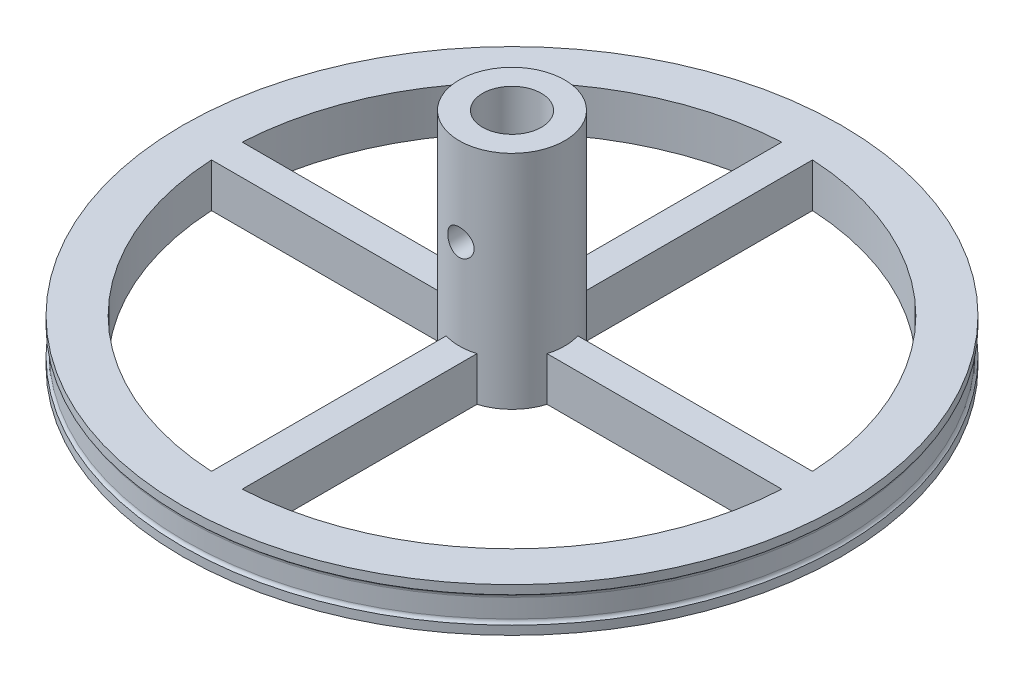
from build123d import *

# Parameters (mm, degrees)
REVOLVE1_ANGLE                 = 90
BOSS_EXTRUDE2_DEPTH            = 22.5
CUT_EXTRUDE1_DEPTH             = 57.762672959
MIRROR3_START                  = -2.736132077
MIRROR3_DEPTH                  = 5
MIRROR3_START_2                = 2.263867923
MIRROR3_2_DEPTH                = 20.236132077
MIRROR3_3_DEPTH                = 1
MIRROR3_START_3                = 1.263867923
MIRROR3_4_DEPTH                = 1
MIRROR4_START                  = -2.736132077
MIRROR4_DEPTH                  = 5
MIRROR4_START_2                = 2.263867923
MIRROR4_2_DEPTH                = 20.236132077
MIRROR4_3_DEPTH                = 1
MIRROR4_START_3                = 1.263867923
MIRROR4_4_DEPTH                = 1
SKETCH7_R                      = 3.35
CUT_EXTRUDE2_DEPTH             = 20
FILLET9_R                      = 0.5
CUT_EXTRUDE3_REACH             = 59.609
SKETCH8_R                      = 1.5
CUT_EXTRUDE3_DIRECTION_2_REACH = 59.609


# Read off the part's stored shape, not the designer's step: Mirror3, Mirror4
with BuildPart() as part:
    # Sketch1 → Revolve1 (revolve)
    with BuildSketch(Plane.XY):
        Polygon((0, 2.263867923), (0, -2.736132077), (37.5, -2.736132077), (37.5, -1.736132077), (37.25, -1.736132077), (37.25, 1.263867923), (37.5, 1.263867923), (37.5, 2.263867923), align=None)
    revolve(axis=Axis((0, 2.263867923, 0), (0, -1, 0)), revolution_arc=REVOLVE1_ANGLE)

    # Sketch2 → Boss-Extrude2 (add)
    with BuildSketch(Plane(origin=(0, 0, 0), x_dir=(1, 0, 0), z_dir=(0, 1, 0))):
        with BuildLine():
            Line((0, 0), (6, 0))
            ThreePointArc((6, 0), (4.242640687, -4.242640687), (0, -6))
            Line((0, -6), (0, 0))
        make_face()
    extrude(amount=BOSS_EXTRUDE2_DEPTH)

    # Sketch6 → Cut-Extrude1 (cut, through all)
    with BuildSketch(Plane(origin=(0, 2.263867923, 0), x_dir=(1, 0, 0), z_dir=(0, 1, 0))):
        with BuildLine():
            Line((1.75, -5.739120142), (1.75, -32.452850414))
            ThreePointArc((1.75, -32.452850414), (22.980970389, -22.980970389), (32.452850414, -1.75))
            Line((32.452850414, -1.75), (5.739120142, -1.75))
            ThreePointArc((5.739120142, -1.75), (4.242640687, -4.242640687), (1.75, -5.739120142))
        make_face()
    extrude(amount=-CUT_EXTRUDE1_DEPTH, mode=Mode.SUBTRACT)

    # Mirror3 outline → Mirror3 (add)
    with BuildSketch(Plane(origin=(0, 0, 0), x_dir=(1, 0, 0), z_dir=(0, 1, 0)).offset(MIRROR3_START)):
        with BuildLine():
            ThreePointArc((37.25, 0), (26.339727599, 26.339727599), (0, 37.25))
            Line((0, 37.25), (0, 0))
            Line((0, 0), (37.25, 0))
        make_face()
        with BuildLine():
            Line((32.452850414, 1.75), (5.739120142, 1.75))
            ThreePointArc((5.739120142, 1.75), (4.242640687, 4.242640687), (1.75, 5.739120142))
            Line((1.75, 5.739120142), (1.75, 32.452850414))
            ThreePointArc((1.75, 32.452850414), (22.980970389, 22.980970389), (32.452850414, 1.75))
        make_face(mode=Mode.SUBTRACT)
    extrude(amount=MIRROR3_DEPTH)

    # Mirror3 2 outline → Mirror3 2 (add)
    with BuildSketch(Plane(origin=(0, 0, 0), x_dir=(1, 0, 0), z_dir=(0, 1, 0)).offset(MIRROR3_START_2)):
        with BuildLine():
            Line((0, 0), (6, 0))
            ThreePointArc((6, 0), (4.242640687, 4.242640687), (0, 6))
            Line((0, 6), (0, 0))
        make_face()
    extrude(amount=MIRROR3_2_DEPTH)

    # Mirror3 3 outline → Mirror3 3 (add)
    with BuildSketch(Plane(origin=(0, 0, 0), x_dir=(1, 0, 0), z_dir=(0, 1, 0)).offset(MIRROR3_START)):
        with BuildLine():
            Line((37.25, 0), (37.5, 0))
            ThreePointArc((37.5, 0), (26.516504294, 26.516504294), (0, 37.5))
            Line((0, 37.5), (0, 37.25))
            ThreePointArc((0, 37.25), (26.339727599, 26.339727599), (37.25, 0))
        make_face()
    extrude(amount=MIRROR3_3_DEPTH)

    # Mirror3 4 outline → Mirror3 4 (add)
    with BuildSketch(Plane(origin=(0, 0, 0), x_dir=(1, 0, 0), z_dir=(0, 1, 0)).offset(MIRROR3_START_3)):
        with BuildLine():
            Line((37.25, 0), (37.5, 0))
            ThreePointArc((37.5, 0), (26.516504294, 26.516504294), (0, 37.5))
            Line((0, 37.5), (0, 37.25))
            ThreePointArc((0, 37.25), (26.339727599, 26.339727599), (37.25, 0))
        make_face()
    extrude(amount=MIRROR3_4_DEPTH)

    # Mirror4 outline → Mirror4 (add)
    with BuildSketch(Plane(origin=(0, 0, 0), x_dir=(1, 0, 0), z_dir=(0, 1, 0)).offset(MIRROR4_START)):
        with BuildLine():
            ThreePointArc((0, 37.25), (-37.25, 0), (0, -37.25))
            Line((0, -37.25), (0, 37.25))
        make_face()
        with BuildLine():
            Line((-1.75, 32.452850414), (-1.75, 5.739120142))
            ThreePointArc((-1.75, 5.739120142), (-4.242640687, 4.242640687), (-5.739120142, 1.75))
            Line((-5.739120142, 1.75), (-32.452850414, 1.75))
            ThreePointArc((-32.452850414, 1.75), (-22.980970389, 22.980970389), (-1.75, 32.452850414))
        make_face(mode=Mode.SUBTRACT)
        with BuildLine():
            Line((-32.452850414, -1.75), (-5.739120142, -1.75))
            ThreePointArc((-5.739120142, -1.75), (-4.242640687, -4.242640687), (-1.75, -5.739120142))
            Line((-1.75, -5.739120142), (-1.75, -32.452850414))
            ThreePointArc((-1.75, -32.452850414), (-22.980970389, -22.980970389), (-32.452850414, -1.75))
        make_face(mode=Mode.SUBTRACT)
    extrude(amount=MIRROR4_DEPTH)

    # Mirror4 2 outline → Mirror4 2 (add)
    with BuildSketch(Plane(origin=(0, 0, 0), x_dir=(1, 0, 0), z_dir=(0, 1, 0)).offset(MIRROR4_START_2)):
        with BuildLine():
            Line((0, -6), (0, 6))
            ThreePointArc((0, 6), (-6, 0), (0, -6))
        make_face()
    extrude(amount=MIRROR4_2_DEPTH)

    # Mirror4 3 outline → Mirror4 3 (add)
    with BuildSketch(Plane(origin=(0, 0, 0), x_dir=(1, 0, 0), z_dir=(0, 1, 0)).offset(MIRROR4_START)):
        with BuildLine():
            Line((0, 37.25), (0, 37.5))
            ThreePointArc((0, 37.5), (-37.5, 0), (0, -37.5))
            Line((0, -37.5), (0, -37.25))
            ThreePointArc((0, -37.25), (-37.25, 0), (0, 37.25))
        make_face()
    extrude(amount=MIRROR4_3_DEPTH)

    # Mirror4 4 outline → Mirror4 4 (add)
    with BuildSketch(Plane(origin=(0, 0, 0), x_dir=(1, 0, 0), z_dir=(0, 1, 0)).offset(MIRROR4_START_3)):
        with BuildLine():
            Line((0, 37.25), (0, 37.5))
            ThreePointArc((0, 37.5), (-37.5, 0), (0, -37.5))
            Line((0, -37.5), (0, -37.25))
            ThreePointArc((0, -37.25), (-37.25, 0), (0, 37.25))
        make_face()
    extrude(amount=MIRROR4_4_DEPTH)

    # Sketch7 → Cut-Extrude2 (cut)
    with BuildSketch(Plane(origin=(0, 22.5, 0), x_dir=(1, 0, 0), z_dir=(0, 1, 0))):
        with Locations(Location((0, 0, 0), (0, 0, 270))):
            Circle(SKETCH7_R)
    extrude(amount=-CUT_EXTRUDE2_DEPTH, mode=Mode.SUBTRACT)

    # Fillet9
    # the kernel refuses this fillet: 0.5 mm, written as the material it adds along each edge
    with BuildSketch(Plane(origin=(0, 1.263867923, 0), x_dir=(0, 0, 1), z_dir=(1, 0, 0))) as fillet9_piece_1:
        with BuildLine():
            CenterArc((37.75, 0.433012702), FILLET9_R, 180, 60)
            Line((37.5, 0), (37.495, -0.008660254))
            ThreePointArc((37.495, -0.008660254), (37.375, -0.01), (37.25, -0.01))
            Line((37.25, -0.01), (37.24, 0))
            Line((37.24, 0), (37.24, 0.433012702))
            Line((37.24, 0.433012702), (37.25, 0.433012702))
        make_face()
    revolve(axis=Axis((0, 1.263867923, 0), (0, -1, 0)), revolution_arc=180)
    with BuildSketch(Plane(origin=(0, -1.736132077, 0), x_dir=(0, 0, 1), z_dir=(1, 0, 0))) as fillet9_piece_2:
        with BuildLine():
            CenterArc((37.75, -0.433012702), FILLET9_R, 120, 60)
            Line((37.25, -0.433012702), (37.24, -0.433012702))
            Line((37.24, -0.433012702), (37.24, 0))
            Line((37.24, 0), (37.25, 0.01))
            ThreePointArc((37.25, 0.01), (37.375, 0.01), (37.495, 0.008660254))
            Line((37.495, 0.008660254), (37.5, 0))
        make_face()
    revolve(axis=Axis((0, -1.736132077, 0), (0, -1, 0)), revolution_arc=180)
    with BuildSketch(Plane(origin=(0, -1.736132077, 0), x_dir=(1, 0, 0), z_dir=(0, 0, -1))) as fillet9_piece_3:
        with BuildLine():
            CenterArc((37.75, -0.433012702), FILLET9_R, 120, 60)
            Line((37.25, -0.433012702), (37.24, -0.433012702))
            Line((37.24, -0.433012702), (37.24, 0))
            Line((37.24, 0), (37.25, 0.01))
            ThreePointArc((37.25, 0.01), (37.375, 0.01), (37.495, 0.008660254))
            Line((37.495, 0.008660254), (37.5, 0))
        make_face()
    revolve(axis=Axis((0, -1.736132077, 0), (0, -1, 0)), revolution_arc=90)
    with BuildSketch(Plane(origin=(-1e-09, -1.736132077, 1e-09), x_dir=(1.823040450855093e-11, 0, -1.0), z_dir=(-1.0, 0, -1.823040450855093e-11))) as fillet9_piece_4:
        with BuildLine():
            CenterArc((37.750000001, -0.433012702), FILLET9_R, 120, 60)
            Line((37.250000001, -0.433012702), (37.240000001, -0.433012702))
            Line((37.240000001, -0.433012702), (37.240000001, 0))
            Line((37.240000001, 0), (37.250000001, 0.01))
            ThreePointArc((37.250000001, 0.01), (37.375000001, 0.01), (37.495000001, 0.008660254))
            Line((37.495000001, 0.008660254), (37.500000001, 0))
        make_face()
    revolve(axis=Axis((-1e-09, -1.736132077, 1e-09), (0, -1, 0)), revolution_arc=89.999999998)
    with BuildSketch(Plane(origin=(0, 1.263867923, 0), x_dir=(1, 0, 0), z_dir=(0, 0, -1))) as fillet9_piece_5:
        with BuildLine():
            CenterArc((37.75, 0.433012702), FILLET9_R, 180, 60)
            Line((37.5, 0), (37.495, -0.008660254))
            ThreePointArc((37.495, -0.008660254), (37.375, -0.01), (37.25, -0.01))
            Line((37.25, -0.01), (37.24, 0))
            Line((37.24, 0), (37.24, 0.433012702))
            Line((37.24, 0.433012702), (37.25, 0.433012702))
        make_face()
    revolve(axis=Axis((0, 1.263867923, 0), (0, -1, 0)), revolution_arc=90)
    with BuildSketch(Plane(origin=(-1e-09, 1.263867923, 1e-09), x_dir=(1.823040450855093e-11, 0, -1.0), z_dir=(-1.0, 0, -1.823040450855093e-11))) as fillet9_piece_6:
        with BuildLine():
            CenterArc((37.750000001, 0.433012702), FILLET9_R, 180, 60)
            Line((37.500000001, 0), (37.495000001, -0.008660254))
            ThreePointArc((37.495000001, -0.008660254), (37.375000001, -0.01), (37.250000001, -0.01))
            Line((37.250000001, -0.01), (37.240000001, 0))
            Line((37.240000001, 0), (37.240000001, 0.433012702))
            Line((37.240000001, 0.433012702), (37.250000001, 0.433012702))
        make_face()
    revolve(axis=Axis((-1e-09, 1.263867923, 1e-09), (0, -1, 0)), revolution_arc=89.999999998)

    # Sketch8 → Cut-Extrude3 (cut, up to next)
    with BuildSketch(Plane.XY, mode=Mode.PRIVATE) as cut_extrude3_sk1:
        with Locations((0, 12.5)):
            Circle(SKETCH8_R)
    cut_extrude3_tool1 = extrude(cut_extrude3_sk1.sketch, amount=-CUT_EXTRUDE3_REACH, mode=Mode.PRIVATE) & part.part
    add(cut_extrude3_tool1.solids().sort_by_distance((0, 12.5, 0))[0], mode=Mode.SUBTRACT)

    # Sketch8 → Cut-Extrude3 direction 2 (cut, up to next)
    with BuildSketch(Plane.XY, mode=Mode.PRIVATE) as cut_extrude3_direction_2_sk1:
        with Locations((0, 12.5)):
            Circle(SKETCH8_R)
    cut_extrude3_direction_2_tool1 = extrude(cut_extrude3_direction_2_sk1.sketch, amount=CUT_EXTRUDE3_DIRECTION_2_REACH, mode=Mode.PRIVATE) & part.part
    add(cut_extrude3_direction_2_tool1.solids().sort_by_distance((0, 12.5, 0))[0], mode=Mode.SUBTRACT)


solid = part.part
